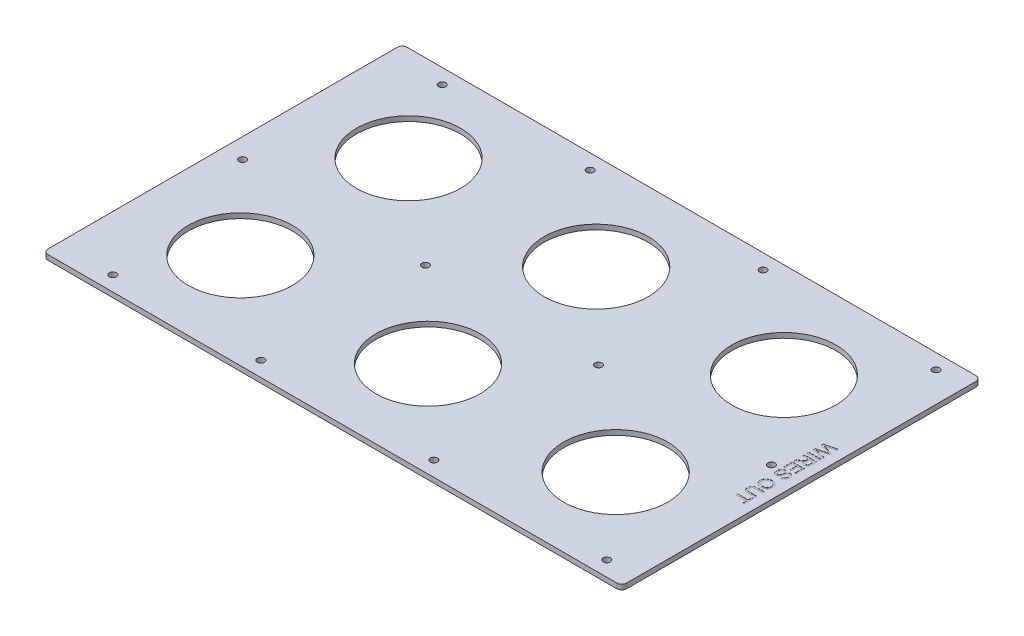
from build123d import *

# Parameters (mm, degrees)
SKETCH1_R           = 33.147
SKETCH1_R_2         = 2.2479
BOSS_EXTRUDE1_DEPTH = 3.175
SKETCH2_W           = 7.704956055
SKETCH2_H           = 1.086596366
CUT_EXTRUDE1_DEPTH  = 0.1


with BuildPart() as part:
    # Sketch1 → Boss-Extrude1 (new body)
    with BuildSketch(Plane(origin=(0, 0, 0), x_dir=(1, 0, 0), z_dir=(0, 1, 0))):
        with BuildLine():
            Line((-180.975, 114.3), (180.975, 114.3))
            ThreePointArc((180.975, 114.3), (183.22006403, 113.37006403), (184.15, 111.125))
            Line((184.15, 111.125), (184.15, -111.125))
            ThreePointArc((184.15, -111.125), (183.22006403, -113.37006403), (180.975, -114.3))
            Line((180.975, -114.3), (-180.975, -114.3))
            ThreePointArc((-180.975, -114.3), (-183.22006403, -113.37006403), (-184.15, -111.125))
            Line((-184.15, -111.125), (-184.15, 111.125))
            ThreePointArc((-184.15, 111.125), (-183.22006403, 113.37006403), (-180.975, 114.3))
        make_face()
        with Locations((119.508581684, -53.5178)):
            Circle(SKETCH1_R, mode=Mode.SUBTRACT)
        with Locations((165.1, 0)):
            Circle(SKETCH1_R_2, mode=Mode.SUBTRACT)
        with Locations((-171.45, 0)):
            Circle(SKETCH1_R_2, mode=Mode.SUBTRACT)
        with Locations((-55.033333333, 0)):
            Circle(SKETCH1_R_2, mode=Mode.SUBTRACT)
        with Locations((55.033333333, 0)):
            Circle(SKETCH1_R_2, mode=Mode.SUBTRACT)
        with Locations((119.508581684, 53.5178)):
            Circle(SKETCH1_R, mode=Mode.SUBTRACT)
        with Locations((0.064290842, 53.5178)):
            Circle(SKETCH1_R, mode=Mode.SUBTRACT)
        with Locations((0.064290842, -53.5178)):
            Circle(SKETCH1_R, mode=Mode.SUBTRACT)
        with Locations((-119.38, 53.5178)):
            Circle(SKETCH1_R, mode=Mode.SUBTRACT)
        with Locations((-119.38, -53.5178)):
            Circle(SKETCH1_R, mode=Mode.SUBTRACT)
        with Locations((-149.225, -104.775)):
            Circle(SKETCH1_R_2, mode=Mode.SUBTRACT)
        with Locations((-55.033333333, -104.775)):
            Circle(SKETCH1_R_2, mode=Mode.SUBTRACT)
        with Locations((55.033333333, -104.775)):
            Circle(SKETCH1_R_2, mode=Mode.SUBTRACT)
        with Locations((165.1, -104.775)):
            Circle(SKETCH1_R_2, mode=Mode.SUBTRACT)
        with Locations((-149.225, 104.775)):
            Circle(SKETCH1_R_2, mode=Mode.SUBTRACT)
        with Locations((-55.033333333, 104.775)):
            Circle(SKETCH1_R_2, mode=Mode.SUBTRACT)
        with Locations((55.033333333, 104.775)):
            Circle(SKETCH1_R_2, mode=Mode.SUBTRACT)
        with Locations((165.1, 104.775)):
            Circle(SKETCH1_R_2, mode=Mode.SUBTRACT)
    extrude(amount=BOSS_EXTRUDE1_DEPTH)

    # Sketch2 → Cut-Extrude1 (cut)
    # profile 1 of 8: a face of its own
    with BuildSketch(Plane(origin=(0, 3.175, 0), x_dir=(1, 0, 0), z_dir=(0, 1, 0))):
        with BuildLine():
            Line((170.15, 27.961088352), (177.854956055, 29.901218512))
            Line((177.854956055, 29.901218512), (177.854956055, 28.779122548))
            Line((177.854956055, 28.779122548), (172.787774419, 27.635418134))
            add(Edge.make_bspline(
                [(172.787774419, 27.635418134), (172.526439394, 27.576144258), (172.006437361, 27.458201643), (171.486146355, 27.341540415), (171.227335602, 27.283509083)],
                knots=[0, 0, 0, 0, 1.00513078, 2, 2, 2, 2], degree=3))
            add(Edge.make_bspline(
                [(171.227335602, 27.283509083), (171.320397544, 27.256033068), (171.496081531, 27.204163359), (171.745130513, 27.134045564), (171.962493539, 27.070359817), (172.149183924, 27.016102829), (172.305463956, 26.972171156), (172.429413275, 26.934241048), (172.523459211, 26.908388361), (172.575307048, 26.893068011), (172.596385286, 26.886839671)],
                knots=[0, 0, 0, 0, 1.633809233, 3.084334118, 4.356383392, 5.447555203, 6.357852567, 7.089694452, 7.629924063, 8, 8, 8, 8], degree=3))
            Line((172.596385286, 26.886839671), (177.854956055, 25.364987373))
            Line((177.854956055, 25.364987373), (177.854956055, 24.05767612))
            Line((177.854956055, 24.05767612), (173.994760724, 22.957188606))
            add(Edge.make_bspline(
                [(173.994760724, 22.957188606), (173.756292996, 22.89645702), (173.286086246, 22.776707475), (172.585695874, 22.617600876), (171.902297114, 22.470750571), (171.450303241, 22.386162037), (171.227335602, 22.344434689)],
                knots=[0, 0, 0, 0, 1.04154457, 2.053700482, 3.039894486, 4, 4, 4, 4], degree=3))
            add(Edge.make_bspline(
                [(171.227335602, 22.344434689), (171.341544592, 22.318678763), (171.581775196, 22.264502978), (171.961078373, 22.179659286), (172.376649739, 22.085427655), (172.666345356, 22.020262905), (172.817100173, 21.986351796)],
                knots=[0, 0, 0, 0, 0.862132589, 1.813435466, 2.862132822, 4, 4, 4, 4], degree=3))
            Line((172.817100173, 21.986351796), (177.854956055, 20.848821224))
            Line((177.854956055, 20.848821224), (177.854956055, 19.72672526))
            Line((177.854956055, 19.72672526), (170.15, 21.668398882))
            Line((170.15, 21.668398882), (170.15, 22.863037501))
            Line((170.15, 22.863037501), (176.038302754, 24.472867061))
            add(Edge.make_bspline(
                [(176.038302754, 24.472867061), (176.095866386, 24.489032069), (176.205215852, 24.519739564), (176.361261246, 24.559989898), (176.49849675, 24.59990494), (176.618695907, 24.63165342), (176.720647484, 24.659129071), (176.804052983, 24.683459935), (176.870544784, 24.699108893), (176.908336746, 24.710425493), (176.924249224, 24.715190398)],
                knots=[0, 0, 0, 0, 1.562239628, 2.967673567, 4.210417925, 5.296319877, 6.215971374, 6.969386481, 7.566055473, 8, 8, 8, 8], degree=3))
            add(Edge.make_bspline(
                [(176.924249224, 24.715190398), (176.823339965, 24.743760525), (176.632671059, 24.797744024), (176.364249146, 24.877691092), (176.128224928, 24.944775082), (175.982204514, 24.987287741), (175.914825894, 25.00690448)],
                knots=[0, 0, 0, 0, 1.197730334, 2.263121701, 3.198547257, 4, 4, 4, 4], degree=3))
            Line((175.914825894, 25.00690448), (170.15, 26.675385549))
            Line((170.15, 26.675385549), (170.15, 27.961088352))
        make_face()
    # profile 2 of 8: a face of its own
    with BuildSketch(Plane(origin=(0, 3.175, 0), x_dir=(1, 0, 0), z_dir=(0, 1, 0))):
        with Locations((174.002478027, 18.393175174)):
            Rectangle(SKETCH2_W, SKETCH2_H)
    # profile 3 of 8: a face of its own
    with BuildSketch(Plane(origin=(0, 3.175, 0), x_dir=(1, 0, 0), z_dir=(0, 1, 0))):
        with BuildLine():
            Line((170.15, 16.071810209), (177.854956055, 16.071810209))
            Line((177.854956055, 16.071810209), (177.854956055, 12.728674228))
            add(Edge.make_bspline(
                [(177.854956055, 12.728674228), (177.854342169, 12.649953238), (177.853154065, 12.497597974), (177.844664156, 12.276657496), (177.826627338, 12.070918982), (177.80648242, 11.879085777), (177.776738051, 11.701486143), (177.741842552, 11.538035421), (177.700600095, 11.389360543), (177.651849918, 11.254330055), (177.596714064, 11.129041547), (177.528649233, 11.012939725), (177.454187738, 10.901048546), (177.36599881, 10.79779432), (177.271171835, 10.698657305), (177.165018988, 10.607025217), (177.049039409, 10.522450855), (176.88323027, 10.418093644), (176.661277756, 10.308286085), (176.378699292, 10.214565599), (176.082488889, 10.154645397), (175.880129247, 10.148194124), (175.777457888, 10.144920936)],
                knots=[0, 0, 0, 0, 1.242122331, 2.403982386, 3.487329914, 4.500326623, 5.446523787, 6.327028739, 7.136568587, 7.878666205, 8.590811102, 9.292609518, 9.999600102, 10.708452415, 11.431798422, 12.162621657, 12.917616336, 13.694634159, 15.252079616, 16.810286496, 18.381632726, 20, 20, 20, 20], degree=3))
            add(Edge.make_bspline(
                [(175.777457888, 10.144920936), (175.711548467, 10.146428673), (175.581372842, 10.149406557), (175.389979623, 10.172217122), (175.207111885, 10.213491869), (175.031164423, 10.266415741), (174.864643565, 10.338863029), (174.704098084, 10.422752234), (174.554124584, 10.526823622), (174.409729605, 10.643032409), (174.27735816, 10.778133103), (174.155231091, 10.928521812), (174.049716509, 11.097983524), (173.954892757, 11.283399851), (173.87191545, 11.485107238), (173.802148968, 11.704447002), (173.747529022, 11.940642486), (173.720168895, 12.104438229), (173.706133564, 12.188462967)],
                knots=[0, 0, 0, 0, 0.98268397, 1.940868231, 2.867803148, 3.77529712, 4.675825539, 5.571570676, 6.471608834, 7.392971743, 8.331421822, 9.286283743, 10.275919943, 11.301762849, 12.388744527, 13.524158817, 14.729930953, 16, 16, 16, 16], degree=3))
            add(Edge.make_bspline(
                [(173.706133564, 12.188462967), (173.674920512, 12.126355334), (173.615845378, 12.008807813), (173.521004725, 11.846671272), (173.427149071, 11.707441492), (173.358518569, 11.627134073), (173.32644222, 11.589600196)],
                knots=[0, 0, 0, 0, 1.172410807, 2.218954047, 3.167579294, 4, 4, 4, 4], degree=3))
            add(Edge.make_bspline(
                [(173.32644222, 11.589600196), (173.255189411, 11.516690791), (173.109061635, 11.367165608), (172.857854964, 11.163118967), (172.581599523, 10.961217248), (172.380287097, 10.839999673), (172.276888911, 10.777739843)],
                knots=[0, 0, 0, 0, 0.918170575, 1.883016652, 2.912673989, 4, 4, 4, 4], degree=3))
            Line((172.276888911, 10.777739843), (170.15, 9.51364549))
            Line((170.15, 9.51364549), (170.15, 10.759218314))
            Line((170.15, 10.759218314), (171.776807629, 11.719250899))
            add(Edge.make_bspline(
                [(171.776807629, 11.719250899), (171.83388517, 11.753770269), (171.944492072, 11.82066314), (172.106043884, 11.917264227), (172.254720969, 12.012064055), (172.39502939, 12.099702086), (172.523321014, 12.184866155), (172.643423074, 12.262773792), (172.750587872, 12.339419067), (172.879655605, 12.428558525), (173.020135853, 12.53602905), (173.163546222, 12.662288619), (173.280644656, 12.779443783), (173.393767744, 12.926020862), (173.499175465, 13.107903077), (173.548162123, 13.2621855), (173.571852479, 13.336797763)],
                knots=[0, 0, 0, 0, 1.130769053, 2.191244754, 3.190605808, 4.119719489, 4.995392299, 5.800890497, 6.546104885, 7.228445539, 8.4599972, 9.541354885, 10.466489475, 11.262010607, 12.675885558, 14, 14, 14, 14], degree=3))
            add(Edge.make_bspline(
                [(173.571852479, 13.336797763), (173.577500255, 13.368116191), (173.590394299, 13.439617099), (173.59881542, 13.561025464), (173.607753313, 13.708126592), (173.607492893, 13.814733287), (173.607352076, 13.872378643)],
                knots=[0, 0, 0, 0, 0.709978628, 1.620902492, 2.713552433, 4, 4, 4, 4], degree=3))
            Line((173.607352076, 13.872378643), (173.607352076, 14.985213842))
            Line((173.607352076, 14.985213842), (170.15, 14.985213842))
            Line((170.15, 14.985213842), (170.15, 16.071810209))
        make_face()
        with BuildLine():
            Line((174.496385467, 14.985213842), (174.496385467, 12.921606822))
            add(Edge.make_bspline(
                [(174.496385467, 12.921606822), (174.498010953, 12.818131107), (174.501049646, 12.624692964), (174.526814867, 12.354180356), (174.568207731, 12.123224381), (174.627615019, 11.927514221), (174.710466004, 11.763177743), (174.813405324, 11.621997246), (174.938654811, 11.501892323), (175.082675269, 11.403733514), (175.239816603, 11.326421186), (175.406050639, 11.27364311), (175.577781332, 11.236872937), (175.694943274, 11.233318325), (175.754305976, 11.231517303)],
                knots=[0, 0, 0, 0, 1.545806995, 2.889741191, 4.055176196, 5.047087691, 5.934047151, 6.79198357, 7.645535072, 8.5133672, 9.386595861, 10.252007348, 11.114340652, 12, 12, 12, 12], degree=3))
            add(Edge.make_bspline(
                [(175.754305976, 11.231517303), (175.797555017, 11.232951406), (175.882267182, 11.235760394), (176.00660112, 11.250486036), (176.124747101, 11.279116179), (176.237329656, 11.316922214), (176.343524199, 11.367438748), (176.44415362, 11.427450329), (176.538660191, 11.499062672), (176.627331793, 11.58109049), (176.708014285, 11.675273332), (176.777625776, 11.78285228), (176.836780526, 11.902978864), (176.88372969, 12.035792713), (176.921281378, 12.180875438), (176.946263306, 12.339052963), (176.964340145, 12.509601909), (176.965385302, 12.627782438), (176.965922664, 12.688544249)],
                knots=[0, 0, 0, 0, 0.965208469, 1.890559848, 2.786986821, 3.67262109, 4.535197034, 5.405224191, 6.282113641, 7.175449223, 8.095446547, 9.040936516, 10.026471658, 11.075712529, 12.17809725, 13.364958037, 14.645208957, 16, 16, 16, 16], degree=3))
            Line((176.965922664, 12.688544249), (176.965922664, 14.985213842))
            Line((176.965922664, 14.985213842), (174.496385467, 14.985213842))
        make_face(mode=Mode.SUBTRACT)
    # profile 4 of 8: a face of its own
    with BuildSketch(Plane(origin=(0, 3.175, 0), x_dir=(1, 0, 0), z_dir=(0, 1, 0))):
        Polygon((170.15, 8.366854154), (177.854956055, 8.366854154), (177.854956055, 2.933872321), (176.965922664, 2.933872321), (176.965922664, 7.280257787), (174.595166955, 7.280257787), (174.595166955, 3.230216784), (173.706133564, 3.230216784), (173.706133564, 7.280257787), (171.039033391, 7.280257787), (171.039033391, 2.736309345), (170.15, 2.736309345), align=None)
    # profile 5 of 8: a face of its own
    with BuildSketch(Plane(origin=(0, 3.175, 0), x_dir=(1, 0, 0), z_dir=(0, 1, 0))):
        with BuildLine():
            Line((172.817100173, 1.649712978), (172.817100173, 0.563116612))
            add(Edge.make_bspline(
                [(172.817100173, 0.563116612), (172.719529547, 0.55118181), (172.532091121, 0.528254415), (172.266572277, 0.463828653), (172.027103843, 0.381894422), (171.813378129, 0.276322875), (171.622868444, 0.143315233), (171.453133612, -0.02036123), (171.304803803, -0.218512442), (171.174859032, -0.4429847), (171.070412857, -0.691453169), (170.994464873, -0.957129776), (170.949054567, -1.23860425), (170.943227367, -1.431381137), (170.940251903, -1.529816163)],
                knots=[0, 0, 0, 0, 1.125661535, 2.162456423, 3.124646671, 4.021152204, 4.884793578, 5.777140414, 6.711097021, 7.712275503, 8.742730725, 9.791526725, 10.872317486, 12, 12, 12, 12], degree=3))
            add(Edge.make_bspline(
                [(170.940251903, -1.529816163), (170.941819683, -1.616925729), (170.944867379, -1.786262852), (170.983138859, -2.03186214), (171.036140789, -2.263122392), (171.116837446, -2.475819976), (171.216803452, -2.667610301), (171.333562111, -2.836243924), (171.470054812, -2.977492406), (171.621328485, -3.091228496), (171.781808171, -3.179580468), (171.947407209, -3.241156078), (172.114852611, -3.282617797), (172.228290067, -3.287124205), (172.284606215, -3.289361416)],
                knots=[0, 0, 0, 0, 1.267278989, 2.463534024, 3.612003651, 4.716903637, 5.765847919, 6.755281273, 7.693132489, 8.613187884, 9.50174055, 10.350585091, 11.181146174, 12, 12, 12, 12], degree=3))
            add(Edge.make_bspline(
                [(172.284606215, -3.289361416), (172.340361107, -3.286980485), (172.44944591, -3.282322178), (172.607031773, -3.246084289), (172.753131638, -3.18611117), (172.890132122, -3.103620997), (173.016624795, -2.990167719), (173.130896592, -2.845289916), (173.23753008, -2.669664303), (173.294640421, -2.537999343), (173.324898759, -2.468240298)],
                knots=[0, 0, 0, 0, 0.942390321, 1.843792698, 2.718029279, 3.604523015, 4.535311134, 5.574971969, 6.71516581, 8, 8, 8, 8], degree=3))
            add(Edge.make_bspline(
                [(173.324898759, -2.468240298), (173.336038523, -2.441095474), (173.361205274, -2.379770385), (173.394512326, -2.274659324), (173.437633321, -2.149946001), (173.481664466, -2.003028917), (173.529488087, -1.834117372), (173.581413831, -1.643598744), (173.638859547, -1.431720009), (173.698586397, -1.204568749), (173.759741738, -0.974806555), (173.821279669, -0.754883511), (173.882810477, -0.552226285), (173.942950569, -0.365744369), (174.002973634, -0.196521687), (174.061649313, -0.043689521), (174.117725486, 0.092961504), (174.158959254, 0.176422276), (174.178432553, 0.215837943)],
                knots=[0, 0, 0, 0, 0.499203687, 1.127791816, 1.87544445, 2.745218927, 3.737540508, 4.863437871, 6.106074846, 7.473929386, 8.860961239, 10.152791525, 11.360569269, 12.465464948, 13.48744072, 14.416013254, 15.251937243, 16, 16, 16, 16], degree=3))
            add(Edge.make_bspline(
                [(174.178432553, 0.215837943), (174.227453266, 0.306492871), (174.322076001, 0.481480474), (174.490532585, 0.717165955), (174.679258812, 0.914070835), (174.884477608, 1.074916628), (175.105652176, 1.200127373), (175.340782189, 1.287464351), (175.587937475, 1.345042812), (175.75758007, 1.350562364), (175.8438267, 1.353368515)],
                knots=[0, 0, 0, 0, 1.158753891, 2.236696577, 3.247844099, 4.216965963, 5.160353944, 6.094570301, 7.031275781, 8, 8, 8, 8], degree=3))
            add(Edge.make_bspline(
                [(175.8438267, 1.353368515), (175.939353844, 1.349711142), (176.129356641, 1.342436656), (176.408077734, 1.277590875), (176.676902372, 1.174858408), (176.889101036, 1.055430773), (177.050484968, 0.9409555), (177.166533853, 0.846005171), (177.273177181, 0.7394844), (177.374079474, 0.626053123), (177.465299504, 0.500793222), (177.550012637, 0.367603512), (177.62591779, 0.223714846), (177.718462775, 0.020001856), (177.813344915, -0.250954281), (177.895550253, -0.592110615), (177.943672273, -0.951191604), (177.950334996, -1.196284123), (177.953737543, -1.321448962)],
                knots=[0, 0, 0, 0, 1.2001067, 2.387003517, 3.579163215, 4.810460134, 5.437089112, 6.066784591, 6.693680817, 7.331043701, 7.974292474, 8.640345033, 9.314862782, 10.018578828, 11.453312207, 12.917685044, 14.425910937, 16, 16, 16, 16], degree=3))
            add(Edge.make_bspline(
                [(177.953737543, -1.321448962), (177.95064289, -1.458457698), (177.944628528, -1.724729918), (177.893241849, -2.11224948), (177.806583877, -2.473940214), (177.708523054, -2.757920025), (177.609571266, -2.967538932), (177.53234372, -3.116454719), (177.443058966, -3.254678403), (177.346438672, -3.383455396), (177.242524161, -3.503973872), (177.1288586, -3.613166454), (177.009263724, -3.715660518), (176.837994981, -3.836392166), (176.609571361, -3.963703311), (176.316835367, -4.079710236), (176.005116832, -4.153165156), (175.79069382, -4.169895507), (175.681763321, -4.178394807)],
                knots=[0, 0, 0, 0, 1.607767564, 3.124646298, 4.577694013, 5.968230118, 6.64098443, 7.297468537, 7.935727887, 8.569831019, 9.186231226, 9.801209789, 10.418260488, 11.033239051, 12.257996117, 13.47812891, 14.718847046, 16, 16, 16, 16], degree=3))
            Line((175.681763321, -4.178394807), (175.681763321, -3.09179844))
            add(Edge.make_bspline(
                [(175.681763321, -3.09179844), (175.736991235, -3.085121667), (175.845167038, -3.072043764), (176.000627725, -3.035343897), (176.146673573, -2.991484403), (176.281547317, -2.935573378), (176.406478451, -2.869526654), (176.519006724, -2.789517406), (176.623476803, -2.701824511), (176.7170098, -2.602061317), (176.79917029, -2.490043204), (176.870345488, -2.365689122), (176.93051157, -2.22903876), (176.979778568, -2.080142075), (177.017981321, -1.918989761), (177.04608314, -1.745209435), (177.060475535, -1.558869965), (177.063269785, -1.430540804), (177.064704152, -1.364665863)],
                knots=[0, 0, 0, 0, 1.074597235, 2.104830896, 3.08320792, 4.01963776, 4.922947153, 5.808618242, 6.683501764, 7.556007728, 8.44518997, 9.363001905, 10.32032511, 11.326760392, 12.390579697, 13.518793479, 14.726327422, 16, 16, 16, 16], degree=3))
            add(Edge.make_bspline(
                [(177.064704152, -1.364665863), (177.064188603, -1.296191701), (177.063190627, -1.163642565), (177.04497071, -0.972031657), (177.020009591, -0.794419061), (176.983061434, -0.631172241), (176.935259434, -0.48306628), (176.878759403, -0.348127523), (176.808568824, -0.229165201), (176.730017114, -0.123337493), (176.6422554, -0.032590228), (176.552332374, 0.04825144), (176.456418072, 0.114942834), (176.357692752, 0.172218581), (176.251920942, 0.212597101), (176.143699666, 0.244199872), (176.030749928, 0.26343676), (175.954001215, 0.265644988), (175.914825894, 0.266772148)],
                knots=[0, 0, 0, 0, 1.464643987, 2.835190547, 4.115048982, 5.300866033, 6.411522794, 7.442255218, 8.424145068, 9.359957701, 10.255529779, 11.121374133, 11.943044406, 12.751479056, 13.556984722, 14.358492815, 15.162115312, 16, 16, 16, 16], degree=3))
            add(Edge.make_bspline(
                [(175.914825894, 0.266772148), (175.848535839, 0.263964127), (175.719872954, 0.258514018), (175.537081779, 0.202860432), (175.370455779, 0.117264828), (175.279795424, 0.032939519), (175.234159704, -0.009507326)],
                knots=[0, 0, 0, 0, 1.050964922, 2.039826012, 3.013306874, 4, 4, 4, 4], degree=3))
            add(Edge.make_bspline(
                [(175.234159704, -0.009507326), (175.211353151, -0.036265364), (175.160917867, -0.095439112), (175.094172776, -0.205541019), (175.026734837, -0.342050915), (174.95969881, -0.50588171), (174.892236885, -0.696747973), (174.822828427, -0.914357869), (174.75352998, -1.159949087), (174.68786178, -1.425399641), (174.620323302, -1.693158031), (174.554159897, -1.94737748), (174.491105264, -2.181180377), (174.429661483, -2.39378823), (174.3699322, -2.585403373), (174.310682432, -2.755364006), (174.256187029, -2.905044225), (174.217845165, -2.996741066), (174.200041003, -3.039320775)],
                knots=[0, 0, 0, 0, 0.523891657, 1.158554055, 1.913784378, 2.794767528, 3.797522645, 4.933640231, 6.202082727, 7.603978424, 9.013314845, 10.322177672, 11.523239011, 12.626145434, 13.623952425, 14.517289202, 15.3114987, 16, 16, 16, 16], degree=3))
            add(Edge.make_bspline(
                [(174.200041003, -3.039320775), (174.174500713, -3.094720645), (174.124369403, -3.203461308), (174.03874435, -3.35748149), (173.949951708, -3.501295096), (173.854808999, -3.633621889), (173.755274208, -3.755235267), (173.650208558, -3.865395), (173.539279991, -3.963419415), (173.387095799, -4.079694724), (173.18160789, -4.198915332), (172.916061967, -4.301366499), (172.632339623, -4.365447691), (172.436720388, -4.372411065), (172.33708388, -4.375957782)],
                knots=[0, 0, 0, 0, 0.899337291, 1.765248388, 2.59684015, 3.3906421, 4.166844185, 4.912752363, 5.632941945, 6.347675468, 7.734877245, 9.118505574, 10.532342477, 12, 12, 12, 12], degree=3))
            add(Edge.make_bspline(
                [(172.33708388, -4.375957782), (172.236386957, -4.371936712), (172.036470096, -4.36395355), (171.741783397, -4.295215649), (171.456233631, -4.187232042), (171.229634162, -4.060594514), (171.056545098, -3.940883774), (170.93213659, -3.840321106), (170.817101966, -3.728802888), (170.70783741, -3.609074587), (170.606572276, -3.480206624), (170.513272081, -3.341112563), (170.426965579, -3.193260476), (170.321796053, -2.982131414), (170.211778741, -2.701716945), (170.12016005, -2.344525205), (170.060724739, -1.968088374), (170.054431046, -1.70960361), (170.051218512, -1.577663446)],
                knots=[0, 0, 0, 0, 1.197055466, 2.376552968, 3.581957237, 4.820753935, 5.454298064, 6.085440993, 6.72202542, 7.359198513, 8.013298489, 8.67051481, 9.351020706, 10.049282741, 11.476266879, 12.925760103, 14.430794493, 16, 16, 16, 16], degree=3))
            add(Edge.make_bspline(
                [(170.051218512, -1.577663446), (170.051932124, -1.493774815), (170.053334356, -1.328935451), (170.069501726, -1.087448361), (170.093600447, -0.856087262), (170.128757691, -0.635455897), (170.175582001, -0.424932359), (170.230391417, -0.224755681), (170.295589613, -0.034943867), (170.370653227, 0.144407329), (170.45847565, 0.31317942), (170.552967218, 0.474260222), (170.660935572, 0.624666673), (170.777495386, 0.766440108), (170.90495526, 0.898586507), (171.042667389, 1.020296391), (171.189846784, 1.133703907), (171.346843703, 1.236636861), (171.51179862, 1.328556123), (171.681888346, 1.411227403), (171.858361077, 1.480876648), (172.04032109, 1.537007954), (172.226551739, 1.584553832), (172.418606514, 1.617525841), (172.61588251, 1.641767961), (172.749631443, 1.647048996), (172.817100173, 1.649712978)],
                knots=[0, 0, 0, 0, 1.259794174, 2.475468585, 3.633483936, 4.752716887, 5.828920721, 6.87130154, 7.868357378, 8.841438305, 9.788394823, 10.72402761, 11.64389108, 12.56602382, 13.478685853, 14.398289622, 15.324106125, 16.267144882, 17.215109807, 18.158654996, 19.105737623, 20.061356657, 21.017194371, 21.990367343, 22.986254633, 24, 24, 24, 24], degree=3))
        make_face()
    # profile 6 of 8: a face of its own
    with BuildSketch(Plane(origin=(0, 3.175, 0), x_dir=(1, 0, 0), z_dir=(0, 1, 0))):
        with BuildLine():
            add(Edge.make_bspline(
                [(173.900609618, -8.425998786), (174.055081669, -8.428694796), (174.356062626, -8.433947835), (174.794424224, -8.482451377), (175.206372887, -8.562468316), (175.593814211, -8.672539898), (175.953826157, -8.818938733), (176.290835694, -8.992648386), (176.598977129, -9.203414764), (176.881813297, -9.44156709), (177.13183827, -9.707645267), (177.353902315, -9.990924446), (177.539128475, -10.294964077), (177.692064615, -10.61694928), (177.809484454, -10.958249569), (177.891689051, -11.317906262), (177.944718998, -11.695534823), (177.950687696, -11.953652778), (177.953737543, -12.085544219)],
                knots=[0, 0, 0, 0, 1.203593535, 2.345140965, 3.431924157, 4.471254512, 5.478692091, 6.45615896, 7.42038538, 8.382007041, 9.33218277, 10.260966195, 11.182476517, 12.100814648, 13.034113903, 13.98924309, 14.972556454, 16, 16, 16, 16], degree=3))
            add(Edge.make_bspline(
                [(177.953737543, -12.085544219), (177.95223205, -12.172538328), (177.949242413, -12.345292894), (177.92604708, -12.601155131), (177.88575633, -12.850128244), (177.82976435, -13.09239012), (177.759109178, -13.328180354), (177.672548098, -13.557980453), (177.568394749, -13.780318023), (177.450509038, -13.995778855), (177.317137252, -14.201003465), (177.172838256, -14.395800246), (177.014428229, -14.576977984), (176.844200606, -14.745618019), (176.662077441, -14.902086759), (176.465794782, -15.044435187), (176.258348333, -15.175541601), (176.038126778, -15.292583269), (175.80954347, -15.397424581), (175.571444416, -15.486980624), (175.326741852, -15.563894658), (175.07397214, -15.628274471), (174.81322586, -15.674469633), (174.5456254, -15.71125507), (174.270296467, -15.730616317), (174.084306855, -15.734076707), (173.990130341, -15.735828889)],
                knots=[0, 0, 0, 0, 1.034309052, 2.053950705, 3.051627699, 4.031038476, 5.008402854, 5.97643726, 6.948041091, 7.925482047, 8.894385902, 9.856059247, 10.805611944, 11.752954998, 12.703138077, 13.657545741, 14.63347317, 15.618750787, 16.620694897, 17.621667406, 18.641309059, 19.669521506, 20.720627516, 21.788266251, 22.880080611, 24, 24, 24, 24], degree=3))
            add(Edge.make_bspline(
                [(173.990130341, -15.735828889), (173.894400856, -15.734223508), (173.705270752, -15.731051801), (173.425867721, -15.709590737), (173.154485773, -15.671854724), (172.89031569, -15.621804333), (172.633907442, -15.554738322), (172.384525807, -15.475040727), (172.143656456, -15.378641786), (171.910717724, -15.269770601), (171.688917422, -15.146580274), (171.479791576, -15.010702469), (171.285350504, -14.861997946), (171.103010706, -14.702881937), (170.937034874, -14.529344076), (170.782553665, -14.345109437), (170.644492727, -14.147092662), (170.518944798, -13.93910018), (170.411027958, -13.721828008), (170.314145289, -13.50016061), (170.232639446, -13.273833225), (170.165956648, -13.043411329), (170.115039301, -12.808700966), (170.077899318, -12.570128905), (170.055994419, -12.326734054), (170.052818662, -12.163274971), (170.051218512, -12.080913837)],
                knots=[0, 0, 0, 0, 1.141388526, 2.255009839, 3.338557341, 4.406873761, 5.458773361, 6.496627797, 7.526383469, 8.5499449, 9.560445588, 10.548978906, 11.520676971, 12.476877461, 13.431305422, 14.380871584, 15.340724931, 16.306479833, 17.274880643, 18.230982746, 19.189541512, 20.140849708, 21.088988189, 22.051132196, 23.018035844, 24, 24, 24, 24], degree=3))
            add(Edge.make_bspline(
                [(170.051218512, -12.080913837), (170.052528787, -11.99235929), (170.055124115, -11.816954908), (170.081026503, -11.557701725), (170.120549018, -11.304901397), (170.177580407, -11.059274573), (170.252078913, -10.821209344), (170.341729647, -10.590664853), (170.447011444, -10.367082235), (170.569050918, -10.151990124), (170.703771887, -9.945588467), (170.852902666, -9.752061504), (171.013159083, -9.570855645), (171.186954622, -9.404194744), (171.370984715, -9.249456036), (171.566441848, -9.106345782), (171.774479892, -8.977040926), (171.993938674, -8.862215955), (172.219261686, -8.75867657), (172.450327829, -8.671394586), (172.683783429, -8.59470373), (172.921053663, -8.533623993), (173.16159486, -8.48495174), (173.40500579, -8.452222973), (173.651649233, -8.428586066), (173.817205205, -8.426865552), (173.900609618, -8.425998786)],
                knots=[0, 0, 0, 0, 1.072763531, 2.124875893, 3.153923666, 4.171672792, 5.177320289, 6.174136357, 7.166947757, 8.169130198, 9.168574722, 10.151174515, 11.127106349, 12.097106019, 13.066163601, 14.038804255, 15.030068075, 16.031241659, 17.038395341, 18.032966873, 19.022680693, 20.014630449, 21.000093848, 21.9946263, 22.989725266, 24, 24, 24, 24], degree=3))
        make_face()
        with BuildLine():
            add(Edge.make_bspline(
                [(173.888261932, -9.512595152), (173.77702354, -9.514259367), (173.560116526, -9.517504467), (173.243885821, -9.554664291), (172.945475501, -9.610982081), (172.664187725, -9.688837377), (172.402090309, -9.792783692), (172.158679948, -9.919870313), (171.932806148, -10.068946061), (171.727028661, -10.239932497), (171.542110003, -10.427808901), (171.380522743, -10.6285772), (171.245780728, -10.842050877), (171.133236179, -11.06540357), (171.046521017, -11.301596651), (170.985221165, -11.549498526), (170.946958365, -11.809104334), (170.942515242, -11.986114189), (170.940251903, -12.076283455)],
                knots=[0, 0, 0, 0, 1.215616022, 2.370365452, 3.475740397, 4.533490648, 5.5560781, 6.552384115, 7.530550651, 8.509299237, 9.471863928, 10.40830403, 11.321168121, 12.226759389, 13.137923578, 14.065605683, 15.014614662, 16, 16, 16, 16], degree=3))
            add(Edge.make_bspline(
                [(170.940251903, -12.076283455), (170.942547084, -12.167981906), (170.947041042, -12.347527214), (170.984658358, -12.611035426), (171.048700226, -12.861397749), (171.133954491, -13.101095614), (171.249203608, -13.325795898), (171.38416011, -13.540752261), (171.54907148, -13.740110402), (171.734322624, -13.928742793), (171.94487094, -14.097996592), (172.175640444, -14.247932155), (172.429498885, -14.370569547), (172.702795399, -14.472871113), (172.997245083, -14.553118235), (173.312845349, -14.609218486), (173.648764275, -14.643815053), (173.879429026, -14.647394768), (173.997847645, -14.649232522)],
                knots=[0, 0, 0, 0, 0.976909331, 1.912785716, 2.828990727, 3.727421029, 4.617481149, 5.514840137, 6.426786422, 7.368873452, 8.327895072, 9.299698503, 10.295216142, 11.325792517, 12.405818789, 13.542541501, 14.738390493, 16, 16, 16, 16], degree=3))
            add(Edge.make_bspline(
                [(173.997847645, -14.649232522), (174.074026949, -14.648576465), (174.223463174, -14.647289517), (174.443733875, -14.630246006), (174.657152916, -14.60826209), (174.863444819, -14.574791138), (175.061755607, -14.528664261), (175.25359385, -14.477562353), (175.437310628, -14.413665527), (175.613611038, -14.341150391), (175.781645562, -14.260062351), (175.939797177, -14.168406551), (176.08844042, -14.067965498), (176.227160837, -13.958538977), (176.356248251, -13.840512018), (176.475392601, -13.713550008), (176.585291485, -13.577342457), (176.684993755, -13.432678235), (176.774801118, -13.281839518), (176.85157848, -13.125047311), (176.919495675, -12.964474231), (176.970301799, -12.797906792), (177.012868442, -12.628041867), (177.044233091, -12.453881376), (177.06071217, -12.274169217), (177.063363936, -12.152971849), (177.064704152, -12.091718062)],
                knots=[0, 0, 0, 0, 1.220471707, 2.394123819, 3.538599016, 4.658184489, 5.740257119, 6.800339203, 7.838063059, 8.854709651, 9.853990799, 10.825506309, 11.781362566, 12.726491381, 13.654344845, 14.581758638, 15.513997413, 16.45624495, 17.395131889, 18.32430312, 19.252156584, 20.185670527, 21.111507116, 22.057642305, 23.018322208, 24, 24, 24, 24], degree=3))
            add(Edge.make_bspline(
                [(177.064704152, -12.091718062), (177.062940709, -12.005153248), (177.059450855, -11.833841485), (177.022280059, -11.58227072), (176.965226381, -11.339996794), (176.886881467, -11.106580908), (176.781927429, -10.883305753), (176.655519592, -10.668690572), (176.505870504, -10.463724928), (176.334786896, -10.268536293), (176.137326902, -10.086645702), (175.904702471, -9.932781615), (175.642270604, -9.803127369), (175.350752665, -9.694860824), (175.027874716, -9.612312878), (174.67503106, -9.555261338), (174.291848458, -9.519240323), (174.026230008, -9.514866837), (173.888261932, -9.512595152)],
                knots=[0, 0, 0, 0, 0.895069985, 1.771343461, 2.624796936, 3.468163849, 4.31361133, 5.172690577, 6.041527277, 6.935393444, 7.854933085, 8.810158187, 9.810009302, 10.877887247, 12.021813459, 13.252239476, 14.572752642, 16, 16, 16, 16], degree=3))
        make_face(mode=Mode.SUBTRACT)
    # profile 7 of 8: a face of its own
    with BuildSketch(Plane(origin=(0, 3.175, 0), x_dir=(1, 0, 0), z_dir=(0, 1, 0))):
        with BuildLine():
            Line((177.854956055, -21.959062625), (177.854956055, -23.045658992))
            Line((177.854956055, -23.045658992), (173.422136786, -23.045658992))
            add(Edge.make_bspline(
                [(173.422136786, -23.045658992), (173.327978025, -23.044530037), (173.144744923, -23.04233309), (172.87751552, -23.032256431), (172.625152076, -23.012526979), (172.387984581, -22.98263983), (172.165358078, -22.947868846), (171.95747002, -22.905126483), (171.76487779, -22.852521728), (171.585292653, -22.792891256), (171.417944256, -22.72031767), (171.258473681, -22.637942355), (171.108464103, -22.539540722), (170.965998728, -22.429681499), (170.830860433, -22.307236666), (170.704516797, -22.170910437), (170.585596562, -22.022206858), (170.473731591, -21.86168919), (170.373517385, -21.687440869), (170.286556153, -21.499507166), (170.214593946, -21.297743823), (170.154185521, -21.083313868), (170.108679796, -20.855622672), (170.074457981, -20.615568659), (170.054276394, -20.362444742), (170.052252901, -20.18926407), (170.051218512, -20.100735884)],
                knots=[0, 0, 0, 0, 1.311228972, 2.551653728, 3.723130164, 4.834785825, 5.879510353, 6.860250358, 7.788314549, 8.658288427, 9.492697459, 10.325875345, 11.154513055, 11.987074685, 12.828985206, 13.690719442, 14.572384718, 15.478595216, 16.41253076, 17.367739602, 18.35808817, 19.392369757, 20.467218117, 21.588802345, 22.767420464, 24, 24, 24, 24], degree=3))
            add(Edge.make_bspline(
                [(170.051218512, -20.100735884), (170.052490787, -20.01427752), (170.054969714, -19.845820141), (170.071742685, -19.598962732), (170.101437547, -19.364139321), (170.140500218, -19.140676798), (170.19299588, -18.929675729), (170.258309816, -18.731388235), (170.333642949, -18.544522173), (170.419653938, -18.3688505), (170.519724411, -18.206995458), (170.626597632, -18.054786855), (170.747028022, -17.916727312), (170.876478573, -17.790158702), (171.016013245, -17.674891964), (171.166962781, -17.573185792), (171.327162206, -17.481098069), (171.500752098, -17.404668778), (171.686027254, -17.335656808), (171.886890931, -17.277853527), (172.103807622, -17.228240495), (172.33641729, -17.189491727), (172.58486153, -17.155679983), (172.849788182, -17.136023373), (173.130766664, -17.121064253), (173.323332391, -17.119547802), (173.422136786, -17.118769719)],
                knots=[0, 0, 0, 0, 1.193081066, 2.324625372, 3.412172001, 4.45804146, 5.453311625, 6.409738988, 7.336564304, 8.231938232, 9.104965612, 9.959995908, 10.795526766, 11.6289435, 12.456168255, 13.289131264, 14.138038169, 15.002361749, 15.903123796, 16.86470204, 17.884288495, 18.972113175, 20.117801365, 21.342981521, 22.636698715, 24, 24, 24, 24], degree=3))
            Line((173.422136786, -17.118769719), (177.854956055, -17.118769719))
            Line((177.854956055, -17.118769719), (177.854956055, -18.205366086))
            Line((177.854956055, -18.205366086), (173.473070991, -18.205366086))
            add(Edge.make_bspline(
                [(173.473070991, -18.205366086), (173.39332164, -18.206076084), (173.239444092, -18.207446037), (173.016535136, -18.214593494), (172.809677124, -18.228887412), (172.618553588, -18.246557744), (172.443856941, -18.27085368), (172.28583575, -18.301959253), (172.143975526, -18.336874351), (171.978002618, -18.389053433), (171.793455941, -18.47620245), (171.595481423, -18.610760483), (171.426591401, -18.779480668), (171.285005806, -18.977727043), (171.173640734, -19.202906266), (171.095570728, -19.453429361), (171.046645574, -19.726855205), (171.041627536, -19.917360943), (171.039033391, -20.015845543)],
                knots=[0, 0, 0, 0, 1.09016621, 2.103491781, 3.048002782, 3.92413717, 4.726764113, 5.45776374, 6.124688997, 6.722968542, 7.833563451, 8.900618832, 9.979749949, 11.078524919, 12.217069639, 13.398089285, 14.65490594, 16, 16, 16, 16], degree=3))
            add(Edge.make_bspline(
                [(171.039033391, -20.015845543), (171.040468925, -20.100266075), (171.043240797, -20.263273579), (171.06564222, -20.498316998), (171.106366495, -20.713826909), (171.159315803, -20.911914567), (171.230118179, -21.091158161), (171.316370904, -21.251970548), (171.420011725, -21.392506358), (171.538807414, -21.518084151), (171.683187687, -21.625266473), (171.85567465, -21.713387136), (172.054662189, -21.790732774), (172.282705055, -21.853511759), (172.54014894, -21.899480612), (172.825495002, -21.935352521), (173.139948227, -21.954176827), (173.358833523, -21.957387143), (173.473070991, -21.959062625)],
                knots=[0, 0, 0, 0, 1.111455303, 2.146107705, 3.104026802, 3.996399357, 4.841714416, 5.635894114, 6.391918333, 7.134500369, 7.904030117, 8.746408724, 9.677288091, 10.711075296, 11.855002337, 13.117843725, 14.495786417, 16, 16, 16, 16], degree=3))
            Line((173.473070991, -21.959062625), (177.854956055, -21.959062625))
        make_face()
    # profile 8 of 8: a face of its own
    with BuildSketch(Plane(origin=(0, 3.175, 0), x_dir=(1, 0, 0), z_dir=(0, 1, 0))):
        Polygon((170.15, -26.700574043), (176.965922664, -26.700574043), (176.965922664, -24.231036846), (177.854956055, -24.231036846), (177.854956055, -30.256707607), (176.965922664, -30.256707607), (176.965922664, -27.78717041), (170.15, -27.78717041), align=None)
    extrude(amount=-CUT_EXTRUDE1_DEPTH, mode=Mode.SUBTRACT)


solid = part.part
